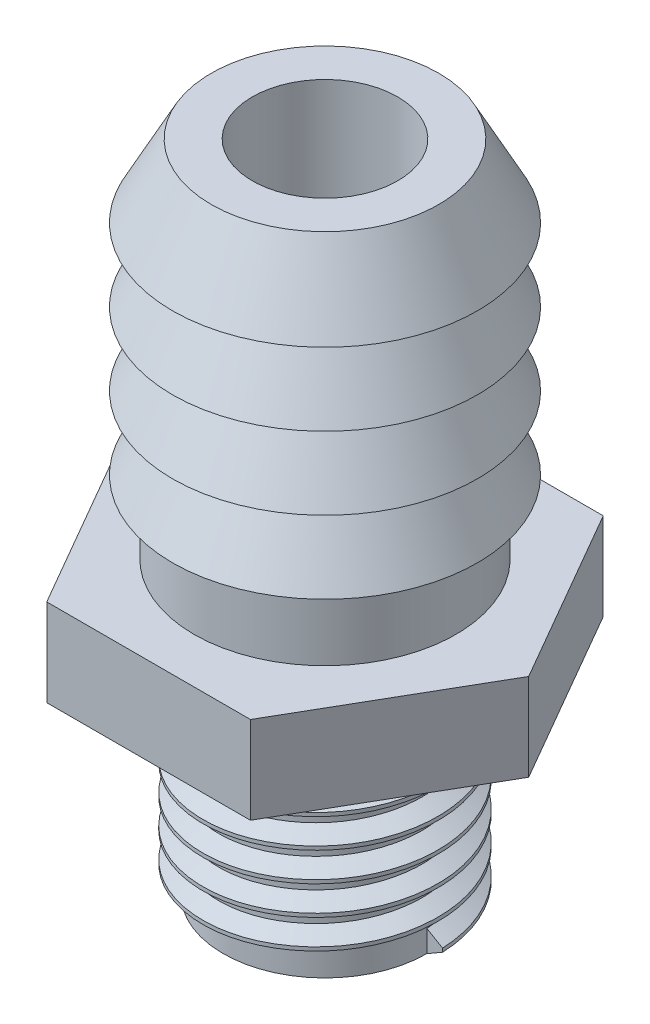
from build123d import *

# Parameters (mm, degrees)
SKETCH1_R               = 5.23875
BOSS_EXTRUDE1_DEPTH     = 2.5
BOSS_EXTRUDE1_TAPER     = 28
LPATTERN1_COUNT         = 4
LPATTERN1_PITCH         = 2.5
SKETCH3_R               = 4.5
SKETCH3_R_2             = 2.5
BOSS_EXTRUDE2_DEPTH     = 2.5
BOSS_EXTRUDE3_DEPTH     = 3
CUT_EXTRUDE1_DEPTH      = 14.629013244
CUT_EXTRUDE1_DEPTH_BACK = 14.629013244
SKETCH4_R               = 2.5
SKETCH6_R               = 3.5
SKETCH6_R_2             = 2.5
BOSS_EXTRUDE4_DEPTH     = 7
THREAD2_PITCH           = 1


with BuildPart() as part:
    # Sketch1 → Boss-Extrude1 (new body)
    with BuildSketch(Plane(origin=(0, 0, 0), x_dir=(1, 0, 0), z_dir=(0, 1, 0))):
        Circle(SKETCH1_R)
    boss_extrude1 = extrude(amount=BOSS_EXTRUDE1_DEPTH, taper=BOSS_EXTRUDE1_TAPER)

    # LPattern1: Boss-Extrude1 ×4
    with Locations(*[(0, -i * LPATTERN1_PITCH, 0) for i in range(1, LPATTERN1_COUNT)]):
        add(boss_extrude1)

    # Sketch3 → Boss-Extrude2 (add)
    with BuildSketch(Plane.XZ.offset(7.5)):
        with Locations(Location((0, 0, 0), (0, 0, 90))):
            Circle(SKETCH3_R)
        with Locations(Location((0, 0, 0), (0, 0, 270))):
            Circle(SKETCH3_R_2, mode=Mode.SUBTRACT)
    extrude(amount=BOSS_EXTRUDE2_DEPTH)

    # Sketch5 → Boss-Extrude3 (add)
    with BuildSketch(Plane.XZ.offset(10)):
        Polygon((3.5, 6.062177826), (-3.5, 6.062177826), (-7, 0), (-3.5, -6.062177826), (3.5, -6.062177826), (7, 0), align=None)
    extrude(amount=BOSS_EXTRUDE3_DEPTH)

    # Sketch4 → Cut-Extrude1 (cut, two sides: drawn at the far end of the back side and taken through both)
    with BuildSketch(Plane.XZ.offset(7.5).offset(-CUT_EXTRUDE1_DEPTH_BACK)):
        with Locations(Location((0, 0, 0), (0, 0, 270))):
            Circle(SKETCH4_R)
    extrude(amount=CUT_EXTRUDE1_DEPTH + CUT_EXTRUDE1_DEPTH_BACK, mode=Mode.SUBTRACT)


with BuildPart() as body_2:
    # Sketch6 → Boss-Extrude4 (new body)
    with BuildSketch(Plane.XZ.offset(13)):
        with Locations(Location((0, 0, 0), (0, 0, 270))):
            Circle(SKETCH6_R)
        with Locations(Location((0, 0, 0), (0, 0, 270))):
            Circle(SKETCH6_R_2, mode=Mode.SUBTRACT)
    extrude(amount=BOSS_EXTRUDE4_DEPTH)

    # Thread2: the profile of Thread Profile3 profile screwed along a right-hand helix of 6 turns, 8 arcs to a turn; built about Z, then put on its axis
    thread2_z = Axis((0, 0, 0), (0, 0, 1))
    thread2_corners = [(3.4997, 0, -0.000173205), (4.041265875, 0, 0.312499999), (4.041265875, 0, 0.437499999), (3.4997, 0, 0.750173202)]
    with BuildLine(mode=Mode.PRIVATE) as thread2_profile:
        Line(thread2_corners[0], thread2_corners[1])
        Line(thread2_corners[1], thread2_corners[2])
        Line(thread2_corners[2], thread2_corners[3])
        Line(thread2_corners[3], thread2_corners[0])
    thread2_cap = Face(thread2_profile.wire())
    thread2_turn_angles = [0, 22.5, 45, 67.5, 90, 112.5, 135, 157.5, 180, 202.5, 225, 247.5, 270, 292.5, 315, 337.5, 360]
    thread2_turn_weights = [1, 0.9238795325112867, 1, 0.9238795325112867, 1, 0.9238795325112867, 1, 0.9238795325112867, 1, 0.9238795325112867, 1, 0.9238795325112867, 1, 0.9238795325112867, 1, 0.9238795325112867, 1]
    thread2_turn_rails = [Edge.make_bspline([Vector(p[0], p[1], 0).rotate(thread2_z, thread2_turn_angles[k]) / thread2_turn_weights[k] + Vector(0, 0, p[2] + THREAD2_PITCH * thread2_turn_angles[k] / 360) for k in range(17)], [0, 0, 0, 1, 1, 2, 2, 3, 3, 4, 4, 5, 5, 6, 6, 7, 7, 8, 8, 8], 2, thread2_turn_weights) for p in thread2_corners]
    thread2_turn_sides = [Face.make_surface_from_curves(thread2_turn_rails[p[0]], thread2_turn_rails[p[1]]) for p in [(0, 1), (1, 2), (2, 3), (3, 0)]]
    thread2 = Plane(origin=(0, -20, 0), x_dir=(1, 0, 0), z_dir=(0, 1, 0)) * Solid(Shell([*[p.moved(Location((0, 0, THREAD2_PITCH * i))) for i in range(6) for p in thread2_turn_sides], thread2_cap, thread2_cap.rotate(thread2_z, 2160).moved(Location((0, 0, THREAD2_PITCH * 2160 / 360)))]))
    add(thread2)


solid = Compound([part.part, body_2.part])
